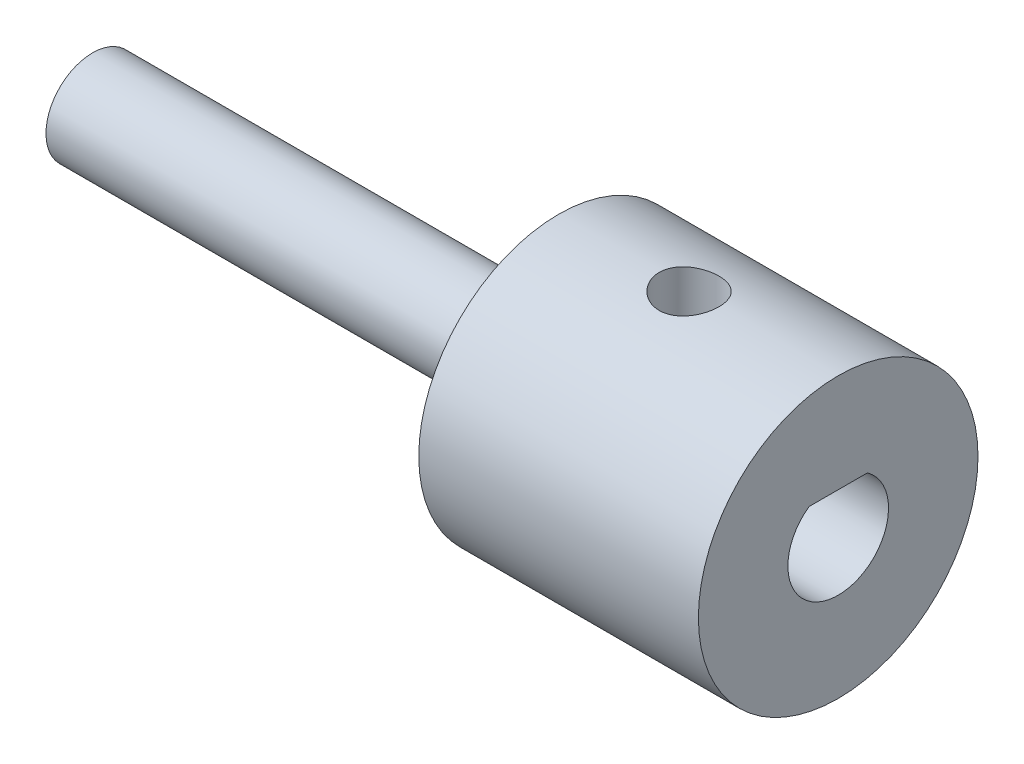
from build123d import *

# Parameters (mm, degrees)
CUT_EXTRUDE1_DEPTH = 10
SKETCH5_R          = 1.6
CUT_EXTRUDE2_DEPTH = 11


with BuildPart() as part:
    # Sketch2 → Revolve1 (revolve)
    with BuildSketch(Plane.XY):
        Polygon((15, 0), (15, 7.5), (0, 7.5), (0, 2.5), (-25, 2.5), (-25, 0), align=None)
    revolve(axis=Axis((15, 0, 0), (-1, 0, 0)))

    # Sketch3 → Cut-Extrude1 (cut)
    with BuildSketch(Plane(origin=(15, 0, 0), x_dir=(0, 0, -1), z_dir=(1, 0, 0))):
        with BuildLine():
            Line((-1.565247584, 2.2), (1.565247584, 2.2))
            ThreePointArc((1.565247584, 2.2), (0, -2.7), (-1.565247584, 2.2))
        make_face()
    extrude(amount=-CUT_EXTRUDE1_DEPTH, mode=Mode.SUBTRACT)

    # Sketch5 → Cut-Extrude2 (cut)
    with BuildSketch(Plane(origin=(0, 0, 0), x_dir=(1, 0, 0), z_dir=(0, 1, 0))):
        with Locations((7, 0)):
            Circle(SKETCH5_R)
    extrude(amount=CUT_EXTRUDE2_DEPTH, mode=Mode.SUBTRACT)


solid = part.part
